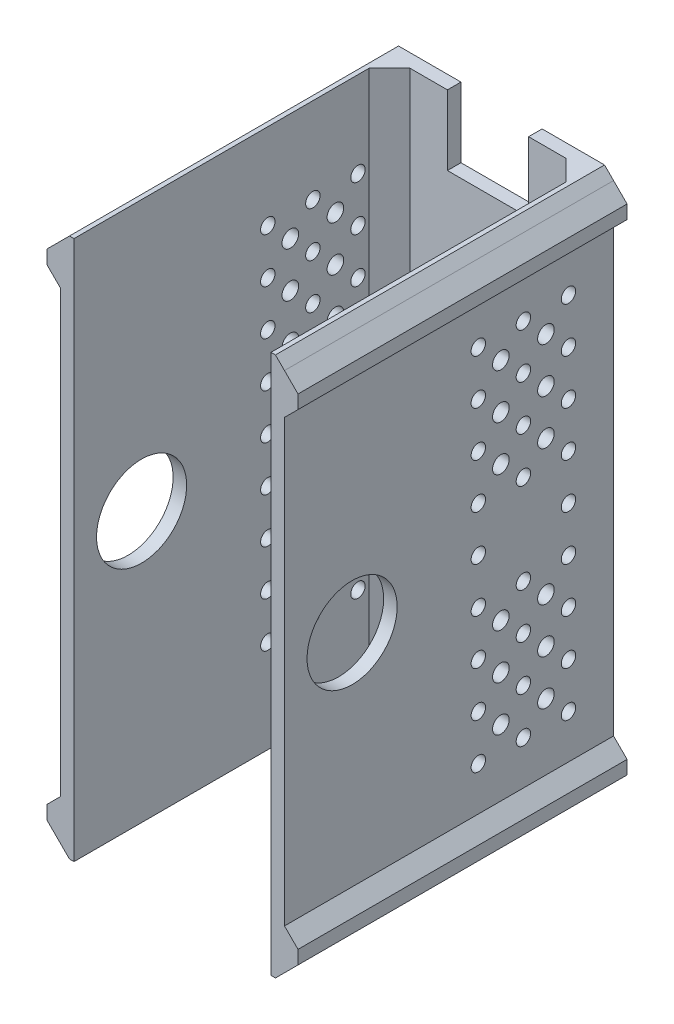
from build123d import *

# Parameters (mm, degrees)
BOSS_EXTRUDE1_DEPTH = 3
BOSS_EXTRUDE2_DEPTH = 70
SKETCH3_R           = 1.65
SKETCH3_R_2         = 2.75
SKETCH3_R_3         = 3.5
CUT_EXTRUDE1_DEPTH  = 3
CHAMFER1_SIZE       = 4.5
CHAMFER2_SIZE       = 3
SKETCH4_R           = 10
SKETCH4_R_2         = 1.6
SKETCH4_R_3         = 1.842058484
CUT_EXTRUDE2_DEPTH  = 138.709585723
CHAMFER3_SIZE       = 2


with BuildPart() as part:
    # Sketch1 → Boss-Extrude1 (new body)
    with BuildSketch(Plane.XY):
        Polygon((9, 0), (-9, 0), (-9, -15.5), (-24.85, -15.5), (-24.85, -10.5), (-27.85, -10.5), (-27.85, -7.5), (-24.85, -7.5), (-24.85, 36.35), (-24.85, 41.85), (-24.85, 46.85), (-24.85, 52.35), (-24.85, 96.2), (-27.85, 96.2), (-27.85, 99.2), (-24.85, 99.2), (-24.85, 104.2), (-9, 104.2), (-9, 88.7), (9, 88.7), (9, 104.2), (24.85, 104.2), (24.85, 99.2), (27.85, 99.2), (27.85, 96.2), (24.85, 96.2), (24.85, 52.35), (24.85, 46.85), (24.85, 41.85), (24.85, 36.35), (24.85, -7.5), (27.85, -7.5), (27.85, -10.5), (24.85, -10.5), (24.85, -15.5), (9, -15.5), align=None)
    extrude(amount=BOSS_EXTRUDE1_DEPTH)

    # Sketch2 → Boss-Extrude2 (add)
    with BuildSketch(Plane.XY.offset(3)):
        Polygon((-24.85, 104.2), (-21.85, 104.2), (-21.85, -15.5), (-24.85, -15.5), (-24.85, -10.5), (-27.85, -10.5), (-27.85, -7.5), (-24.85, -7.5), (-24.85, 96.2), (-27.85, 96.2), (-27.85, 99.2), (-24.85, 99.2), align=None)
        Polygon((21.85, 104.2), (21.85, -15.5), (24.85, -15.5), (24.85, -10.5), (27.85, -10.5), (27.85, -7.5), (24.85, -7.5), (24.85, 96.2), (27.85, 96.2), (27.85, 99.2), (24.85, 99.2), (24.85, 104.2), align=None)
    extrude(amount=BOSS_EXTRUDE2_DEPTH)

    # Sketch3 → Cut-Extrude1 (cut)
    with BuildSketch(Plane(origin=(0, 0, 0), x_dir=(-1, 0, 0), z_dir=(0, 0, -1))):
        with Locations((9, 44.35)):
            Circle(SKETCH3_R)
        with Locations((-4.5, 36.555771366)):
            Circle(SKETCH3_R)
        with Locations((-4.5, 52.144228634)):
            Circle(SKETCH3_R)
        with Locations((0, 44.35)):
            Circle(SKETCH3_R_2)
        with Locations((0, 70.85)):
            Circle(SKETCH3_R_3)
        with Locations((0, 17.85)):
            Circle(SKETCH3_R_3)
    extrude(amount=-CUT_EXTRUDE1_DEPTH, mode=Mode.SUBTRACT)

    # Chamfer1
    chamfer1_edges = [part.edges().sort_by_distance(p)[0] for p in [
        (-21.85, 44.35, 3),
        (21.85, 44.35, 3),
    ]]
    chamfer(chamfer1_edges, length=CHAMFER1_SIZE)

    # Chamfer2
    chamfer2_edges = [part.edges().sort_by_distance(p)[0] for p in [
        (24.85, 99.2, 36.5),
        (24.85, 96.2, 36.5),
        (24.85, -10.5, 36.5),
        (24.85, -7.5, 36.5),
        (-24.85, -7.5, 36.5),
        (-24.85, -10.5, 36.5),
        (-24.85, 99.2, 36.5),
        (-24.85, 96.2, 36.5),
    ]]
    chamfer(chamfer2_edges, length=CHAMFER2_SIZE - 0.0001)  # a hair under: the kernel refuses the full size

    # Sketch4 → Cut-Extrude2 (cut, through all)
    with BuildSketch(Plane.ZY.offset(24.85)):
        with Locations((58, 44.35)):
            Circle(SKETCH4_R)
        with Locations((10, 85.2)):
            Circle(SKETCH4_R_2)
        with Locations((20, 85.2)):
            Circle(SKETCH4_R_2)
        with Locations((30, 85.2)):
            Circle(SKETCH4_R_2)
        with Locations((20, 75.2)):
            Circle(SKETCH4_R_2)
        with Locations((30, 75.2)):
            Circle(SKETCH4_R_2)
        with Locations((20, 65.2)):
            Circle(SKETCH4_R_2)
        with Locations((30, 65.2)):
            Circle(SKETCH4_R_2)
        with Locations((20, 55.2)):
            Circle(SKETCH4_R_2)
        with Locations((30, 55.2)):
            Circle(SKETCH4_R_2)
        with Locations((30, 45.2)):
            Circle(SKETCH4_R_2)
        with Locations((20, 35.2)):
            Circle(SKETCH4_R_2)
        with Locations((30, 35.2)):
            Circle(SKETCH4_R_2)
        with Locations((20, 25.2)):
            Circle(SKETCH4_R_2)
        with Locations((30, 25.2)):
            Circle(SKETCH4_R_2)
        with Locations((20, 15.2)):
            Circle(SKETCH4_R_2)
        with Locations((30, 15.2)):
            Circle(SKETCH4_R_2)
        with Locations((20, 5.2)):
            Circle(SKETCH4_R_2)
        with Locations((30, 5.2)):
            Circle(SKETCH4_R_2)
        with Locations((10, 75.2)):
            Circle(SKETCH4_R_2)
        with Locations((10, 65.2)):
            Circle(SKETCH4_R_2)
        with Locations((10, 55.2)):
            Circle(SKETCH4_R_2)
        with Locations((10, 45.2)):
            Circle(SKETCH4_R_2)
        with Locations((10, 35.2)):
            Circle(SKETCH4_R_2)
        with Locations((10, 25.2)):
            Circle(SKETCH4_R_2)
        with Locations((10, 15.2)):
            Circle(SKETCH4_R_2)
        with Locations((10, 5.2)):
            Circle(SKETCH4_R_2)
        with Locations((15, 80.2)):
            Circle(SKETCH4_R_3)
        with Locations((25, 80.2)):
            Circle(SKETCH4_R_3)
        with Locations((25, 70.2)):
            Circle(SKETCH4_R_3)
        with Locations((25, 60.2)):
            Circle(SKETCH4_R_3)
        with Locations((25, 30.2)):
            Circle(SKETCH4_R_3)
        with Locations((25, 20.2)):
            Circle(SKETCH4_R_3)
        with Locations((25, 10.2)):
            Circle(SKETCH4_R_3)
        with Locations((15, 70.2)):
            Circle(SKETCH4_R_3)
        with Locations((15, 60.2)):
            Circle(SKETCH4_R_3)
        with Locations((15, 30.2)):
            Circle(SKETCH4_R_3)
        with Locations((15, 20.2)):
            Circle(SKETCH4_R_3)
        with Locations((15, 10.2)):
            Circle(SKETCH4_R_3)
    extrude(amount=-CUT_EXTRUDE2_DEPTH, mode=Mode.SUBTRACT)

    # Chamfer3
    chamfer3_edges = [part.edges().sort_by_distance(p)[0] for p in [
        (24.85, -15.5, 36.5),
        (-24.85, -15.5, 36.5),
        (24.85, 104.2, 36.5),
        (-24.85, 104.2, 36.5),
    ]]
    chamfer(chamfer3_edges, length=CHAMFER3_SIZE)


solid = part.part
